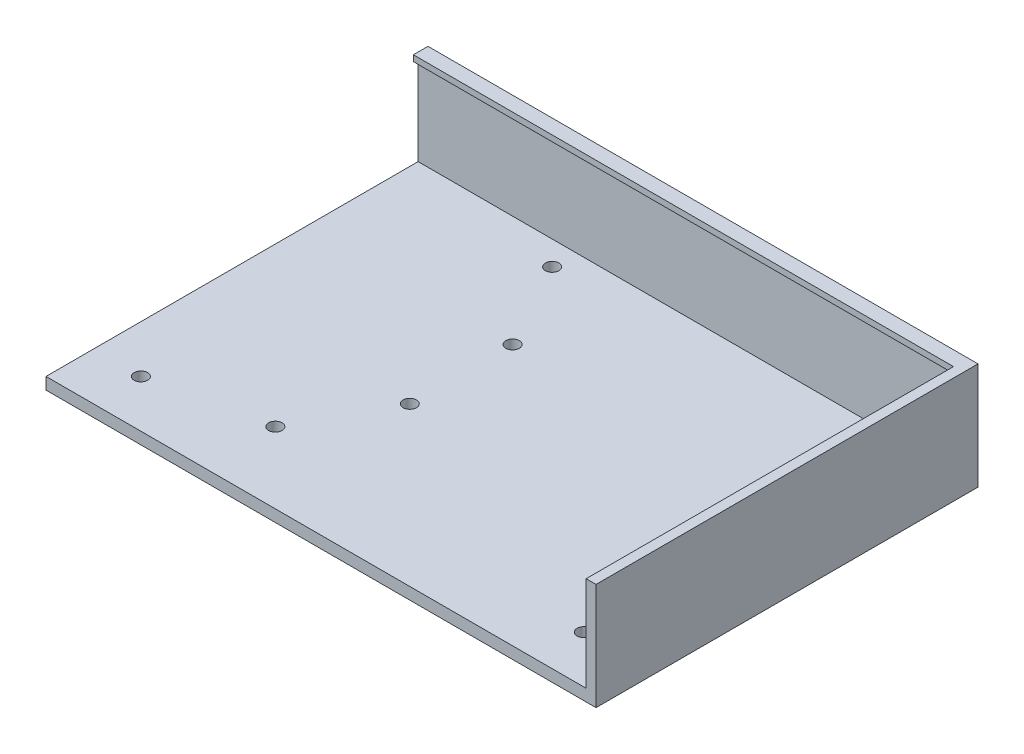
from build123d import *

# Parameters (mm, degrees)
SKETCH1_W                     = 278.2
SKETCH1_H                     = 193.2
SHELL_BLOCK_DEPTH             = 27
SKETCH2_W                     = 273.2
SKETCH2_H                     = 185.8
FRONT_OPENING_DEPTH           = 1.5
SKETCH3_W                     = 273.2
SKETCH3_H                     = 188.2
DISPLAY_POCKET_DEPTH          = 22.5
SKETCH4_W                     = 3
SKETCH4_H                     = 56
VENT_SLOTS_DEPTH              = 4
SKETCH5_W                     = 58
SKETCH5_H                     = 16
CABLE_EXIT_X_SHORT_SIDE_DEPTH = 140.1
SKETCH6_R                     = 1.7
BOLT_HOLES_DEPTH              = 4
KEEP_ONE_HALF_X_DEPTH         = 172.491603293
KEEP_ONE_HALF_X_DEPTH_BACK    = 172.491603293
SKETCH7_W                     = 200
SKETCH7_H                     = 400
KEEP_ONE_QUARTER_Z_DEPTH      = 172.491603293
KEEP_ONE_QUARTER_Z_DEPTH_BACK = 172.491603293
SKETCH8_W                     = 400
SKETCH8_H                     = 200


with BuildPart() as part:
    # Sketch1 → Shell Block (new body)
    with BuildSketch(Plane(origin=(0, 0, 0), x_dir=(1, 0, 0), z_dir=(0, 1, 0))):
        Rectangle(SKETCH1_W, SKETCH1_H)
    extrude(amount=SHELL_BLOCK_DEPTH)

    # Sketch2 → Front Opening (cut)
    with BuildSketch(Plane(origin=(0, 27, 0), x_dir=(1, 0, 0), z_dir=(0, 1, 0))):
        Rectangle(SKETCH2_W, SKETCH2_H)
    extrude(amount=-FRONT_OPENING_DEPTH, mode=Mode.SUBTRACT)

    # Sketch3 → Display Pocket (cut)
    with BuildSketch(Plane(origin=(0, 25.5, 0), x_dir=(1, 0, 0), z_dir=(0, 1, 0))):
        Rectangle(SKETCH3_W, SKETCH3_H)
    extrude(amount=-DISPLAY_POCKET_DEPTH, mode=Mode.SUBTRACT)

    # Sketch4 → Vent Slots (cut)
    with BuildSketch(Plane(origin=(0, 3, 0), x_dir=(1, 0, 0), z_dir=(0, 1, 0))):
        with Locations((-67.5, 56)):
            Rectangle(SKETCH4_W, SKETCH4_H)
        with Locations((-67.5, -56)):
            Rectangle(SKETCH4_W, SKETCH4_H)
        with Locations((-75.5, 56)):
            Rectangle(SKETCH4_W, SKETCH4_H)
        with Locations((-75.5, -56)):
            Rectangle(SKETCH4_W, SKETCH4_H)
        with Locations((-83.5, 56)):
            Rectangle(SKETCH4_W, SKETCH4_H)
        with Locations((-83.5, -56)):
            Rectangle(SKETCH4_W, SKETCH4_H)
        with Locations((-91.5, 56)):
            Rectangle(SKETCH4_W, SKETCH4_H)
        with Locations((-91.5, -56)):
            Rectangle(SKETCH4_W, SKETCH4_H)
        with Locations((-99.5, 56)):
            Rectangle(SKETCH4_W, SKETCH4_H)
        with Locations((-99.5, -56)):
            Rectangle(SKETCH4_W, SKETCH4_H)
        with Locations((-107.5, 56)):
            Rectangle(SKETCH4_W, SKETCH4_H)
        with Locations((-107.5, -56)):
            Rectangle(SKETCH4_W, SKETCH4_H)
        with Locations((-115.5, 56)):
            Rectangle(SKETCH4_W, SKETCH4_H)
        with Locations((-115.5, -56)):
            Rectangle(SKETCH4_W, SKETCH4_H)
        with Locations((-123.5, 56)):
            Rectangle(SKETCH4_W, SKETCH4_H)
        with Locations((-123.5, -56)):
            Rectangle(SKETCH4_W, SKETCH4_H)
    extrude(amount=-VENT_SLOTS_DEPTH, mode=Mode.SUBTRACT)

    # Sketch5 → Cable Exit (-X short side) (cut)
    with BuildSketch(Plane(origin=(0, 0, 0), x_dir=(0, 0, -1), z_dir=(1, 0, 0))):
        with Locations((0, 13)):
            Rectangle(SKETCH5_W, SKETCH5_H)
    extrude(amount=-CABLE_EXIT_X_SHORT_SIDE_DEPTH, mode=Mode.SUBTRACT)

    # Sketch6 → Bolt Holes (cut)
    with BuildSketch(Plane(origin=(0, 3, 0), x_dir=(1, 0, 0), z_dir=(0, 1, 0))):
        with Locations((-40, 18)):
            Circle(SKETCH6_R)
        with Locations((-40, 88)):
            Circle(SKETCH6_R)
        with Locations((40, 18)):
            Circle(SKETCH6_R)
        with Locations((40, 88)):
            Circle(SKETCH6_R)
        with Locations((-52, 40)):
            Circle(SKETCH6_R)
        with Locations((-52, 66)):
            Circle(SKETCH6_R)
        with Locations((52, 40)):
            Circle(SKETCH6_R)
        with Locations((52, 66)):
            Circle(SKETCH6_R)
        with Locations((-12, -82)):
            Circle(SKETCH6_R)
        with Locations((12, -82)):
            Circle(SKETCH6_R)
        with Locations((124, -12)):
            Circle(SKETCH6_R)
        with Locations((124, 12)):
            Circle(SKETCH6_R)
        with Locations((-12, -12)):
            Circle(SKETCH6_R)
        with Locations((-12, 12)):
            Circle(SKETCH6_R)
        with Locations((12, -12)):
            Circle(SKETCH6_R)
        with Locations((12, 12)):
            Circle(SKETCH6_R)
        with Locations((-110, 12)):
            Circle(SKETCH6_R)
        with Locations((-110, -12)):
            Circle(SKETCH6_R)
        with Locations((-86, 12)):
            Circle(SKETCH6_R)
        with Locations((-86, -12)):
            Circle(SKETCH6_R)
    extrude(amount=-BOLT_HOLES_DEPTH, mode=Mode.SUBTRACT)

    # Sketch7 → Keep one half (X) (cut, two sides: drawn at the far end of the back side and taken through both)
    with BuildSketch(Plane(origin=(0, 0, 0), x_dir=(1, 0, 0), z_dir=(0, 1, 0)).offset(-KEEP_ONE_HALF_X_DEPTH_BACK)):
        with Locations((-100, 0)):
            Rectangle(SKETCH7_W, SKETCH7_H)
    extrude(amount=KEEP_ONE_HALF_X_DEPTH + KEEP_ONE_HALF_X_DEPTH_BACK, mode=Mode.SUBTRACT)

    # Sketch8 → Keep one quarter (Z) (cut, two sides: drawn at the far end of the back side and taken through both)
    with BuildSketch(Plane(origin=(0, 0, 0), x_dir=(1, 0, 0), z_dir=(0, 1, 0)).offset(-KEEP_ONE_QUARTER_Z_DEPTH_BACK)):
        with Locations((0, -100)):
            Rectangle(SKETCH8_W, SKETCH8_H)
    extrude(amount=KEEP_ONE_QUARTER_Z_DEPTH + KEEP_ONE_QUARTER_Z_DEPTH_BACK, mode=Mode.SUBTRACT)


solid = part.part
